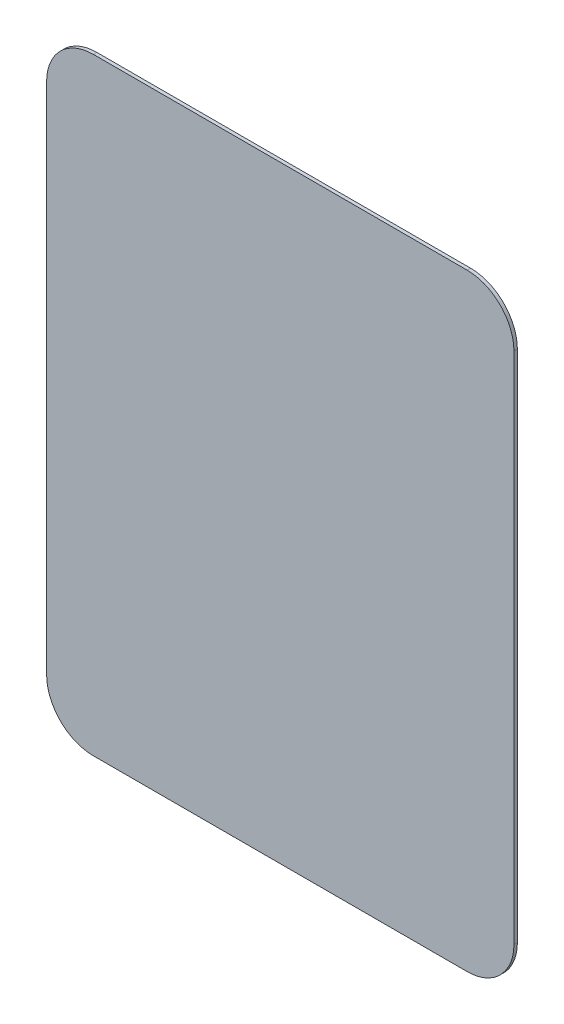
from build123d import *

# Parameters (mm, degrees)
SKETCH2_W           = 100
SKETCH2_H           = 130
BASE_FLANGE1_DEPTH  = 0.7366
BREAK_CORNER1_START = -0.7366
BREAK_CORNER1_DEPTH = 0.7366


# Read off the part's stored shape, not the designer's step: Break-Corner1
# Sheet-metal steps are written as plain solids
with BuildPart() as part:
    # Sketch2 → Base-Flange1 (new body)
    with BuildSketch(Plane.XY):
        with Locations((-20.086956522, -10.739130435)):
            Rectangle(SKETCH2_W, SKETCH2_H)
    extrude(amount=-BASE_FLANGE1_DEPTH)

    # Break-Corner1 outline → Break-Corner1 (cut)
    with BuildSketch(Plane.XY.offset(BREAK_CORNER1_START)):
        with BuildLine():
            ThreePointArc((-70.086956522, 44.260869565), (-67.158024334, 51.331937377), (-60.086956522, 54.260869565))
            Line((-60.086956522, 54.260869565), (-70.086956522, 54.260869565))
            Line((-70.086956522, 54.260869565), (-70.086956522, 44.260869565))
        make_face()
        with BuildLine():
            Line((29.913043478, 54.260869565), (19.913043478, 54.260869565))
            ThreePointArc((19.913043478, 54.260869565), (26.98411129, 51.331937377), (29.913043478, 44.260869565))
            Line((29.913043478, 44.260869565), (29.913043478, 54.260869565))
        make_face()
        with BuildLine():
            ThreePointArc((-60.086956522, -75.739130435), (-67.158024334, -72.810198247), (-70.086956522, -65.739130435))
            Line((-70.086956522, -65.739130435), (-70.086956522, -75.739130435))
            Line((-70.086956522, -75.739130435), (-60.086956522, -75.739130435))
        make_face()
        with BuildLine():
            Line((29.913043478, -75.739130435), (29.913043478, -65.739130435))
            ThreePointArc((29.913043478, -65.739130435), (26.98411129, -72.810198247), (19.913043478, -75.739130435))
            Line((19.913043478, -75.739130435), (29.913043478, -75.739130435))
        make_face()
    extrude(amount=BREAK_CORNER1_DEPTH, mode=Mode.SUBTRACT)


solid = part.part
